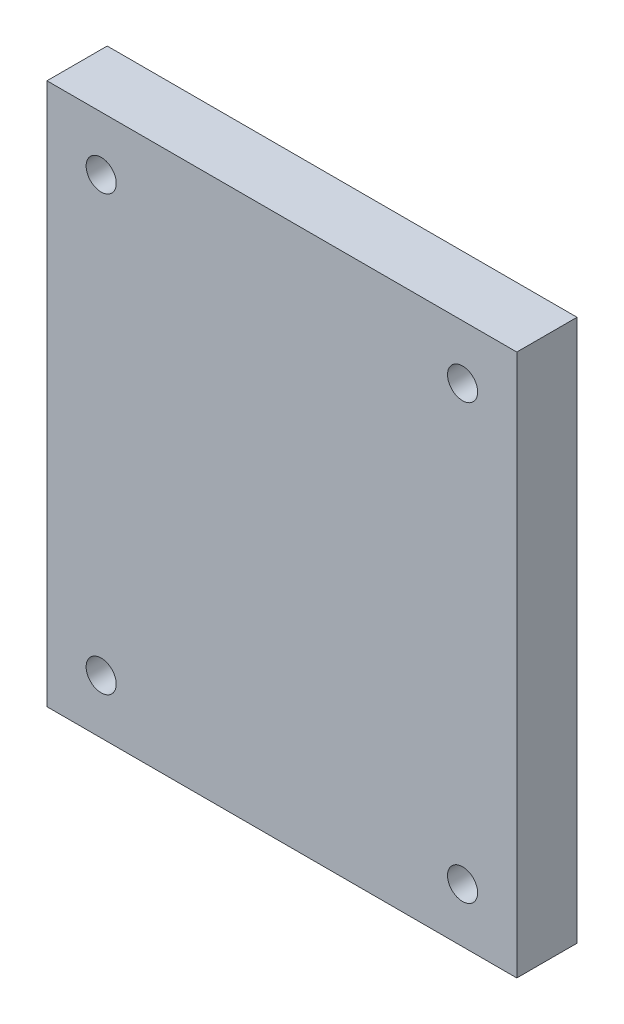
from build123d import *

# Parameters (mm, degrees)
SKETCH1_W           = 39
SKETCH1_H           = 45
SKETCH1_R           = 1.25
BOSS_EXTRUDE1_DEPTH = 5


with BuildPart() as part:
    # Sketch1 → Boss-Extrude1 (new body)
    with BuildSketch(Plane.XY):
        Rectangle(SKETCH1_W, SKETCH1_H)
        with Locations((-15, -18)):
            Circle(SKETCH1_R, mode=Mode.SUBTRACT)
        with Locations((15, -18)):
            Circle(SKETCH1_R, mode=Mode.SUBTRACT)
        with Locations((-15, 18)):
            Circle(SKETCH1_R, mode=Mode.SUBTRACT)
        with Locations((15, 18)):
            Circle(SKETCH1_R, mode=Mode.SUBTRACT)
    extrude(amount=BOSS_EXTRUDE1_DEPTH)


solid = part.part
